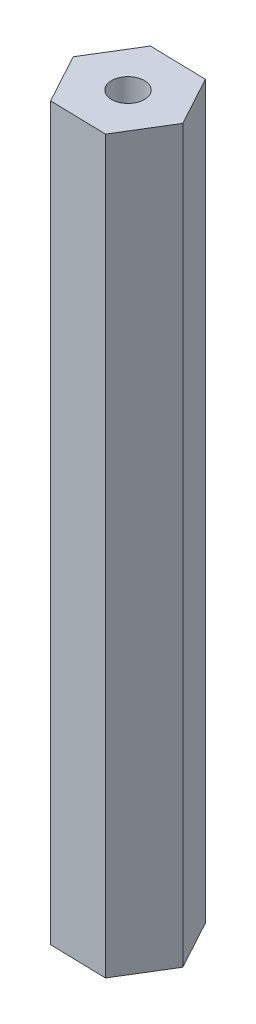
from build123d import *

# Parameters (mm, degrees)
EXTRUDE_1_DEPTH     = 60
SKETCH_2_R          = 1.35
CUT_EXTRUDE_1_DEPTH = 8
CUT_EXTRUDE_START   = -8
SKETCH_3_R          = 1.35
CUT_EXTRUDE_2_DEPTH = 8


with BuildPart() as part:
    # 스케치1 → 보스-돌출1 (new body)
    with BuildSketch(Plane(origin=(0, 0, 0), x_dir=(1, 0, 0), z_dir=(0, 1, 0))):
        Polygon((2.207541846, -4.057103934), (4.617325996, -0.116764648), (2.409784149, 3.940339286), (-2.207541846, 4.057103934), (-4.617325996, 0.116764648), (-2.409784149, -3.940339286), align=None)
    extrude(amount=EXTRUDE_1_DEPTH)

    # 스케치2 → 컷-돌출1 (cut)
    with BuildSketch(Plane(origin=(0, 60, 0), x_dir=(1, 0, 0), z_dir=(0, 1, 0))):
        Circle(SKETCH_2_R)
    extrude(amount=-CUT_EXTRUDE_1_DEPTH, mode=Mode.SUBTRACT)

    # 스케치3 → 컷-돌출2 (cut)
    with BuildSketch(Plane.XZ.offset(CUT_EXTRUDE_START)):
        Circle(SKETCH_3_R)
    extrude(amount=CUT_EXTRUDE_2_DEPTH, mode=Mode.SUBTRACT)


solid = part.part
